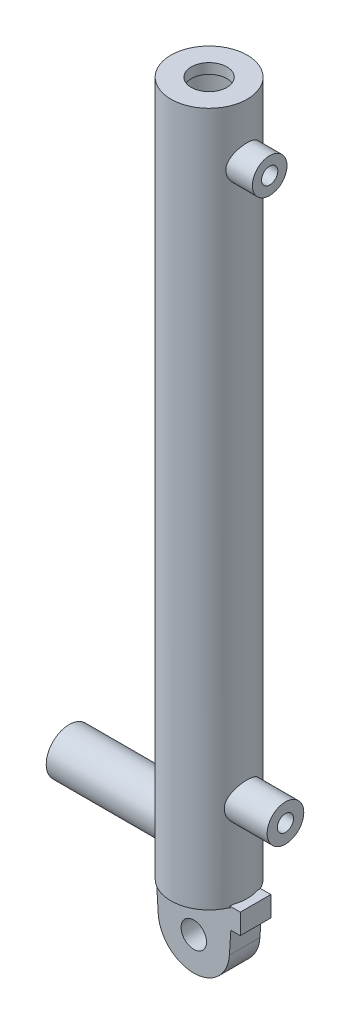
from build123d import *

# Parameters (mm, degrees)
SKETCH1_R                   = 12.5
BOSS_EXTRUDE1_DEPTH         = 15
SKETCH6_R                   = 10
CUT_EXTRUDE1_DEPTH          = 120
REVOLVE_THIN1_START         = 15.5
REVOLVE_THIN1_OUTLINE_R     = 17
REVOLVE_THIN1_OUTLINE_R_2   = 15
REVOLVE_THIN1_OUTLINE_R_3   = 10
REVOLVE_THIN1_OUTLINE_R_4   = 8
REVOLVE_THIN1_DEPTH         = 44
REVOLVE_THIN1_2_OUTLINE_R   = 15
REVOLVE_THIN1_2_OUTLINE_R_2 = 10
REVOLVE_THIN1_2_DEPTH       = 2
REVOLVE_THIN1_START_2       = 57.5
REVOLVE_THIN1_3_OUTLINE_R   = 15
REVOLVE_THIN1_3_OUTLINE_R_2 = 10
REVOLVE_THIN1_3_DEPTH       = 2
SKETCH7_W                   = 75
SKETCH7_H                   = 10


# Read off the part's stored shape, not the designer's step: Revolve-Thin1
with BuildPart() as part:
    # Sketch1 → Boss-Extrude1 (new, symmetric)
    with BuildSketch(Plane.XY):
        with BuildLine():
            Line((37.628606884, 42), (35.5, 42))
            Line((35.5, 42), (35.5, 40))
            Line((35.5, 40), (-37.5, 40))
            Line((-37.5, 40), (-34.927862315, 0))
            ThreePointArc((-34.927862315, 0), (0, -32.754018227), (34.927862315, 0))
            Line((34.927862315, 0), (36.342538042, 22))
            Line((36.342538042, 22), (45.628606884, 22))
            Line((45.628606884, 22), (45.628606884, 42))
            Line((45.628606884, 42), (37.628606884, 42))
        make_face()
        Circle(SKETCH1_R, mode=Mode.SUBTRACT)
    extrude(amount=BOSS_EXTRUDE1_DEPTH, both=True)

    # Sketch2 → Revolve1 (revolve)
    with BuildSketch(Plane.XY):
        Polygon((-37.5, 722), (-17.5, 722), (-17.5, 712), (-32.5, 712), (-32.5, 172), (0, 172), (0, 40), (-37.5, 40), align=None)
    revolve(axis=Axis((0, 722, 0), (0, -1, 0)))


with BuildPart() as body_2:
    # Sketch4 → Revolve2 (revolve)
    with BuildSketch(Plane.XY):
        Polygon((-37.5, 102.5), (-137.5, 102.5), (-137.5, 80), (-37.5, 80), (-27.5, 80), (-27.5, 102.5), align=None)
    revolve(axis=Axis((-37.5, 80, 0), (-1, 0, 0)))


with BuildPart() as cut_extrude1_tool:
    # Sketch6 → Cut-Extrude1 (new body)
    with BuildSketch(Plane.ZY.offset(137.5)):
        with Locations(Location((0, 80, 0), (0, 0, 270))):
            Circle(SKETCH6_R)
    extrude(amount=-CUT_EXTRUDE1_DEPTH)


with BuildPart() as part_1:
    add(part.part)

    # Cut-Extrude1: cut by cut_extrude1_tool
    add(cut_extrude1_tool.part, mode=Mode.SUBTRACT)

    # Revolve-Thin1 outline → Revolve-Thin1 (add)
    # profile 1 of 2: a face of its own
    with BuildSketch(Plane.YZ.offset(REVOLVE_THIN1_START)):
        with Locations((668, 0)):
            Circle(REVOLVE_THIN1_OUTLINE_R)
        with Locations((668, 0)):
            Circle(REVOLVE_THIN1_OUTLINE_R_2, mode=Mode.SUBTRACT)
    # profile 2 of 2: a face of its own
    with BuildSketch(Plane.YZ.offset(REVOLVE_THIN1_START)):
        with Locations((668, 0)):
            Circle(REVOLVE_THIN1_OUTLINE_R_3)
        with Locations((668, 0)):
            Circle(REVOLVE_THIN1_OUTLINE_R_4, mode=Mode.SUBTRACT)
    extrude(amount=REVOLVE_THIN1_DEPTH)

    # Revolve-Thin1 2 outline → Revolve-Thin1 2 (add)
    with BuildSketch(Plane.YZ.offset(REVOLVE_THIN1_START)):
        with Locations((668, 0)):
            Circle(REVOLVE_THIN1_2_OUTLINE_R)
        with Locations((668, 0)):
            Circle(REVOLVE_THIN1_2_OUTLINE_R_2, mode=Mode.SUBTRACT)
    extrude(amount=REVOLVE_THIN1_2_DEPTH)

    # Revolve-Thin1 3 outline → Revolve-Thin1 3 (add)
    with BuildSketch(Plane.YZ.offset(REVOLVE_THIN1_START_2)):
        with Locations((668, 0)):
            Circle(REVOLVE_THIN1_3_OUTLINE_R)
        with Locations((668, 0)):
            Circle(REVOLVE_THIN1_3_OUTLINE_R_2, mode=Mode.SUBTRACT)
    extrude(amount=REVOLVE_THIN1_3_DEPTH)

    # Sketch7 → Revolve3 (revolve)
    with BuildSketch(Plane.XY, mode=Mode.PRIVATE) as revolve3_sk:
        with Locations((37.5, 112)):
            Rectangle(SKETCH7_W, SKETCH7_H)
    revolve(revolve3_sk.sketch.rotate(Axis((75, 125, 0), (-1, 0, 0)), 270), axis=Axis((75, 125, 0), (-1, 0, 0)))


with BuildPart() as body_2_1:
    add(body_2.part)

    # Cut-Extrude1: cut by cut_extrude1_tool
    add(cut_extrude1_tool.part, mode=Mode.SUBTRACT)


solid = Compound([part_1.part, body_2_1.part])
